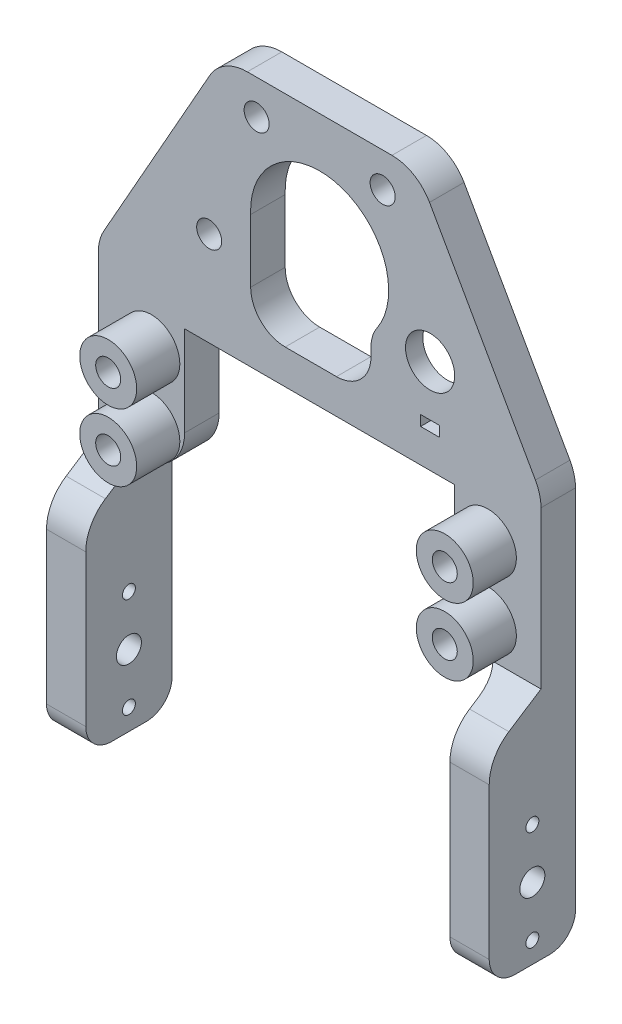
from build123d import *
from OCP.BRepFilletAPI import BRepFilletAPI_MakeChamfer

# Parameters (mm, degrees)
SKETCH1_W                = 65.151
SKETCH1_H                = 29.718
SKETCH1_R                = 1.8415
SKETCH1_W_2              = 39.751
SKETCH1_H_2              = 19.558
BOSS_EXTRUDE1_DEPTH      = 5.08
SKETCH2_R                = 4.191
SKETCH2_R_2              = 1.8415
BOSS_EXTRUDE2_DEPTH      = 6.35
SKETCH3_R                = 1.8415
SKETCH3_R_2              = 3.6195
SKETCH3_R_3              = 10.16
SKETCH3_W                = 20.32
SKETCH3_H                = 10.16
BOSS_EXTRUDE3_DEPTH      = 5.08
CUT_EXTRUDE1_DEPTH       = 2.54
CUT_EXTRUDE2_DEPTH       = 78.913404351
CUT_EXTRUDE2_DEPTH_BACK  = 78.913404351
SKETCH5_W                = 2.794
SKETCH5_H                = 1.524
FILLET1_R                = 6.35
CHAMFER1_SIZE            = 6.35
CUT_EXTRUDE3_DEPTH       = 79.243922304
CUT_EXTRUDE3_DEPTH_BACK  = 79.243922304
SKETCH7_W                = 5.7785
SKETCH7_H                = 38.1
BOSS_EXTRUDE4_DEPTH      = 12.7
CUT_EXTRUDE4_DEPTH       = 84.227055894
CUT_EXTRUDE4_DEPTH_BACK  = 84.227055894
SKETCH8_R                = 1.8415
SKETCH8_W                = 41.273071729
SKETCH8_H                = 30.163795182
CUT_EXTRUDE7_DEPTH       = 79.439508397
CUT_EXTRUDE7_DEPTH_BACK  = 79.439508397
SKETCH13_W               = 7.413158878
SKETCH13_H               = 5.0165
SKETCH13_W_2             = 10.14650482
CHAMFER2_SIZE            = 4.94848586
CHAMFER2_SIZE_2          = 7.62
FILLET4_R                = 3.81
CUT_EXTRUDE9_DEPTH       = 88.443135108
CUT_EXTRUDE9_DEPTH_BACK  = 88.443135108
SKETCH16_R               = 0.9525
FILLET5_R                = 6.35
FILLET6_R                = 2.54
FILLET7_START            = -14
FILLET7_DEPTH            = 67
CUT_EXTRUDE10_DEPTH      = 78.778730238
CUT_EXTRUDE10_DEPTH_BACK = 78.778730238
FILLET8_R                = 5.08


with BuildPart() as part:
    # Sketch1 → Boss-Extrude1 (new body)
    with BuildSketch(Plane.XY):
        with Locations((19.8755, 9.779)):
            Rectangle(SKETCH1_W, SKETCH1_H)
        with Locations((-4.8895, 14.732)):
            Circle(SKETCH1_R, mode=Mode.SUBTRACT)
        with Locations((-4.8895, 4.826)):
            Circle(SKETCH1_R, mode=Mode.SUBTRACT)
        with Locations((44.6405, 14.732)):
            Circle(SKETCH1_R, mode=Mode.SUBTRACT)
        with Locations((44.6405, 4.826)):
            Circle(SKETCH1_R, mode=Mode.SUBTRACT)
        with Locations((19.8755, 9.779)):
            Rectangle(SKETCH1_W_2, SKETCH1_H_2, mode=Mode.SUBTRACT)
    extrude(amount=BOSS_EXTRUDE1_DEPTH)

    # Sketch2 → Boss-Extrude2 (add)
    # profile 1 of 4: a face of its own
    with BuildSketch(Plane.XY.offset(5.08)):
        with Locations((-4.8895, 14.732)):
            Circle(SKETCH2_R)
        with Locations((-4.8895, 14.732)):
            Circle(SKETCH2_R_2, mode=Mode.SUBTRACT)
    # profile 2 of 4: a face of its own
    with BuildSketch(Plane.XY.offset(5.08)):
        with Locations((-4.8895, 4.826)):
            Circle(SKETCH2_R)
        with Locations((-4.8895, 4.826)):
            Circle(SKETCH2_R_2, mode=Mode.SUBTRACT)
    # profile 3 of 4: a face of its own
    with BuildSketch(Plane.XY.offset(5.08)):
        with Locations((44.6405, 14.732)):
            Circle(SKETCH2_R)
        with Locations((44.6405, 14.732)):
            Circle(SKETCH2_R_2, mode=Mode.SUBTRACT)
    # profile 4 of 4: a face of its own
    with BuildSketch(Plane.XY.offset(5.08)):
        with Locations((44.6405, 4.826)):
            Circle(SKETCH2_R)
        with Locations((44.6405, 4.826)):
            Circle(SKETCH2_R_2, mode=Mode.SUBTRACT)
    extrude(amount=BOSS_EXTRUDE2_DEPTH)

    # Sketch3 → Boss-Extrude3 (add)
    # profile 1 of 2: a face of its own
    with BuildSketch(Plane.XY.offset(5.08)):
        Polygon((34.7345, 25.999651961), (37.5285, 25.999651961), (37.5285, 24.638), (52.451, 24.638), (34.2265, 56.924151961), (5.5245, 56.924151961), (-12.7, 24.638), (34.7345, 24.638), align=None)
        with Locations((3.6195, 33.429151961)):
            Circle(SKETCH3_R, mode=Mode.SUBTRACT)
        with Locations((10.6045, 51.844151961)):
            Circle(SKETCH3_R, mode=Mode.SUBTRACT)
        with Locations((36.1315, 33.429151961)):
            Circle(SKETCH3_R_2, mode=Mode.SUBTRACT)
        with Locations((19.8755, 39.461651961)):
            Circle(SKETCH3_R_3, mode=Mode.SUBTRACT)
        with Locations((29.1465, 51.844151961)):
            Circle(SKETCH3_R, mode=Mode.SUBTRACT)
    # profile 2 of 2: a face of its own
    with BuildSketch(Plane.XY.offset(5.08)):
        with Locations((19.8755, -10.16)):
            Rectangle(SKETCH3_W, SKETCH3_H)
        with Locations((14.7955, -10.16)):
            Circle(SKETCH3_R, mode=Mode.SUBTRACT)
        with Locations((24.9555, -10.16)):
            Circle(SKETCH3_R, mode=Mode.SUBTRACT)
    extrude(amount=-BOSS_EXTRUDE3_DEPTH)

    # Sketch4 → Cut-Extrude1 (cut)
    with BuildSketch(Plane(origin=(0, 0, 0), x_dir=(-1, 0, 0), z_dir=(0, 0, -1))):
        with BuildLine():
            Line((-34.657278026, 40.905184972), (-19.8755, 39.461651961))
            Line((-19.8755, 39.461651961), (-30.610615013, 28.177082944))
            ThreePointArc((-30.610615013, 28.177082944), (-43.393319721, 31.120391613), (-34.657278026, 40.905184972))
        make_face()
    extrude(amount=-CUT_EXTRUDE1_DEPTH, mode=Mode.SUBTRACT)

    # Sketch5 → Cut-Extrude2 (cut, two sides: drawn at the far end of the back side and taken through both)
    with BuildSketch(Plane(origin=(0, 0, 2.54), x_dir=(-1, 0, 0), z_dir=(0, 0, -1)).offset(-CUT_EXTRUDE2_DEPTH_BACK)):
        with Locations((-36.1315, 25.237651961)):
            Rectangle(SKETCH5_W, SKETCH5_H)
    extrude(amount=CUT_EXTRUDE2_DEPTH + CUT_EXTRUDE2_DEPTH_BACK, mode=Mode.SUBTRACT)

    # Fillet1
    fillet1_edges = [part.edges().sort_by_distance(p)[0] for p in [
        (5.5245, 56.924151961, 2.54),
        (34.2265, 56.924151961, 2.54),
        (-12.7, 24.638, 2.54),
        (52.451, 24.638, 2.54),
    ]]
    fillet(fillet1_edges, radius=FILLET1_R)

    # Chamfer1
    chamfer1_edges = [part.edges().sort_by_distance(p)[0] for p in [
        (9.7155, -5.08, 2.54),
        (30.0355, -5.08, 2.54),
    ]]
    chamfer(chamfer1_edges, length=CHAMFER1_SIZE)

    # Sketch6 → Cut-Extrude3 (cut, two sides: drawn at the far end of the back side and taken through both)
    with BuildSketch(Plane(origin=(0, 0, 0), x_dir=(-1, 0, 0), z_dir=(0, 0, -1)).offset(-CUT_EXTRUDE3_DEPTH_BACK)):
        Polygon((-52.451, -5.08), (-39.751, -5.08), (-39.751, 0), (0, 0), (0, -5.08), (12.7, -5.08), (12.7, -17.29518095), (-52.451, -17.29518095), align=None)
    extrude(amount=CUT_EXTRUDE3_DEPTH + CUT_EXTRUDE3_DEPTH_BACK, mode=Mode.SUBTRACT)

    # Sketch7 → Boss-Extrude4 (add)
    with BuildSketch(Plane(origin=(0, 0, 0), x_dir=(-1, 0, 0), z_dir=(0, 0, -1))):
        with Locations((-49.56175, -24.13)):
            Rectangle(SKETCH7_W, SKETCH7_H)
        with Locations((9.81075, -24.13)):
            Rectangle(SKETCH7_W, SKETCH7_H)
    extrude(amount=-BOSS_EXTRUDE4_DEPTH)

    # Sketch8 → Cut-Extrude4 (cut, two sides: drawn at the far end of the back side and taken through both)
    with BuildSketch(Plane(origin=(-6.9215, 0, 0), x_dir=(0, 0, -1), z_dir=(1, 0, 0)).offset(-CUT_EXTRUDE4_DEPTH_BACK)):
        with Locations(Location((-6.35, -24.13, 0), (0, 0, 90))):
            Circle(SKETCH8_R)
        with Locations((-3.400089219, -49.689397591)):
            Rectangle(SKETCH8_W, SKETCH8_H)
    extrude(amount=CUT_EXTRUDE4_DEPTH + CUT_EXTRUDE4_DEPTH_BACK, mode=Mode.SUBTRACT)

    # Sketch13 → Cut-Extrude7 (cut, two sides: drawn at the far end of the back side and taken through both)
    with BuildSketch(Plane(origin=(0, 0, 0), x_dir=(-1, 0, 0), z_dir=(0, 0, -1)).offset(-CUT_EXTRUDE7_DEPTH_BACK)):
        with Locations((-42.965920561, -2.57175)):
            Rectangle(SKETCH13_W, SKETCH13_H)
        with Locations((1.84824759, -2.57175)):
            Rectangle(SKETCH13_W_2, SKETCH13_H)
    extrude(amount=CUT_EXTRUDE7_DEPTH + CUT_EXTRUDE7_DEPTH_BACK, mode=Mode.SUBTRACT)

    # Chamfer2
    chamfer2_edges_1 = [part.edges().sort_by_distance(p)[0] for p in [
        (-9.81075, -5.08, 5.08),
    ]]
    chamfer2_side_1 = [part.faces().sort_by_distance(p)[0] for p in [
        (-9.81075, -4.981030283, 5.08),
    ]]
    chamfer2_edges_2 = [part.edges().sort_by_distance(p)[0] for p in [
        (49.56175, -5.08, 5.08),
    ]]
    chamfer2_side_2 = [part.faces().sort_by_distance(p)[0] for p in [
        (49.56175, -4.981030283, 5.08),
    ]]
    chamfer2 = BRepFilletAPI_MakeChamfer(part.part.solid().wrapped)
    for e in chamfer2_edges_1:
        chamfer2.Add(CHAMFER2_SIZE - 0.0001, CHAMFER2_SIZE_2 - 0.0001, e.wrapped, chamfer2_side_1[0].wrapped)
    for e in chamfer2_edges_2:
        chamfer2.Add(CHAMFER2_SIZE - 0.0001, CHAMFER2_SIZE_2 - 0.0001, e.wrapped, chamfer2_side_2[0].wrapped)
    add(Compound.cast(chamfer2.Shape()), mode=Mode.REPLACE)  # a hair under: the kernel refuses the full size

    # Fillet4
    fillet4_edges = [part.edges().sort_by_distance(p)[0] for p in [
        (-9.81075, -34.6075, 12.7),
        (49.56175, -34.6075, 0),
        (49.56175, -34.6075, 12.7),
        (-9.81075, -34.6075, 0),
    ]]
    fillet(fillet4_edges, radius=FILLET4_R)

    # Sketch16 → Cut-Extrude9 (cut, two sides: drawn at the far end of the back side and taken through both)
    with BuildSketch(Plane(origin=(52.451, 0, 0), x_dir=(0, 0, -1), z_dir=(1, 0, 0)).offset(-CUT_EXTRUDE9_DEPTH_BACK)):
        with Locations(Location((-6.35, -16.764, 0), (0, 0, 90))):
            Circle(SKETCH16_R)
        with Locations(Location((-6.35, -31.496, 0), (0, 0, 90))):
            Circle(SKETCH16_R)
    extrude(amount=CUT_EXTRUDE9_DEPTH + CUT_EXTRUDE9_DEPTH_BACK, mode=Mode.SUBTRACT)

    # Fillet5
    fillet5_edges = [part.edges().sort_by_distance(p)[0] for p in [
        (39.751, -0.0635, 2.54),
        (0, -0.0635, 2.54),
    ]]
    fillet(fillet5_edges, radius=FILLET5_R)

    # Fillet6
    # the kernel refuses this fillet: 2.54 mm, written as the material it adds along each edge
    with BuildSketch(Plane(origin=(-6.9215, -0.0635, 10.878299782), x_dir=(0.9968383598531511, 0.07945617864760274, 0), z_dir=(0, 0, -1))) as fillet6_piece_1_section:
        with BuildLine():
            CenterArc((2.347685137, 2.513805752), FILLET6_R, 184.557307561, 77.207046273)
            Line((-0.184284297, 2.311987058), (-0.437481241, 2.291805188))
            Line((-0.437481241, 2.291805188), (-0.253196943, -0.020181869))
            Line((-0.253196943, -0.020181869), (0.020181869, -0.253196943))
            ThreePointArc((0.020181869, -0.253196943), (0.589874992, -0.207787737), (1.947459477, -0.251380575))
            Line((1.947459477, -0.251380575), (1.983843628, 0))
        make_face()
    fillet6_piece_1 = extrude(amount=10.878299782, mode=Mode.PRIVATE)
    fillet6_piece_1 = split(fillet6_piece_1, bisect_by=Plane(origin=(-6.9215, -0.0635, 5.08), z_dir=(0, 0, 1)), keep=Keep.TOP, mode=Mode.PRIVATE)
    fillet6_piece_1 = split(fillet6_piece_1, bisect_by=Plane(origin=(-6.9215, -2.759907111, 9.127244936), z_dir=(0, -0.8386723305166582, -0.5446363208837226)), keep=Keep.TOP, mode=Mode.PRIVATE)
    add(fillet6_piece_1)
    with BuildSketch(Plane(origin=(-6.9215, -0.0635, 5.08), x_dir=(0.9968383598531511, 0.07945617864760274, 0), z_dir=(0, 0, -1))) as fillet6_piece_2_section:
        with BuildLine():
            CenterArc((2.347685137, 2.513805752), FILLET6_R, 184.557307561, 77.207046273)
            Line((-0.184284297, 2.311987058), (-0.437481241, 2.291805188))
            Line((-0.437481241, 2.291805188), (-0.253196943, -0.020181869))
            Line((-0.253196943, -0.020181869), (0.020181869, -0.253196943))
            ThreePointArc((0.020181869, -0.253196943), (0.589874992, -0.207787737), (1.947459477, -0.251380575))
            Line((1.947459477, -0.251380575), (1.983843628, 0))
        make_face()
    fillet6_piece_2 = extrude(amount=5.08, mode=Mode.PRIVATE)
    fillet6_piece_2 = split(fillet6_piece_2, bisect_by=Plane(origin=(-6.9215, -0.11140953, 5.048887408), z_dir=(0, 0.8386723305166582, 0.5446363208837226)), keep=Keep.TOP, mode=Mode.PRIVATE)
    add(fillet6_piece_2)
    with BuildSketch(Plane(origin=(-6.9215, -0.0635, 5.08), x_dir=(0.9968383598531511, 0.07945617864760274, 0), z_dir=(0, 0, -1))) as fillet6_piece_3_section:
        with BuildLine():
            CenterArc((2.347685137, 2.513805752), FILLET6_R, 184.557307561, 77.207046273)
            Line((-0.184284297, 2.311987058), (-0.437481241, 2.291805188))
            Line((-0.437481241, 2.291805188), (-0.253196943, -0.020181869))
            Line((-0.253196943, -0.020181869), (0.020181869, -0.253196943))
            ThreePointArc((0.020181869, -0.253196943), (0.589874992, -0.207787737), (1.947459477, -0.251380575))
            Line((1.947459477, -0.251380575), (1.983843628, 0))
        make_face()
    fillet6_piece_3 = extrude(amount=5.08, mode=Mode.PRIVATE)
    fillet6_piece_3 = split(fillet6_piece_3, bisect_by=Plane(origin=(-6.9215, -0.11140953, 5.048887408), z_dir=(0, -0.8386723305166582, -0.5446363208837226)), keep=Keep.TOP, mode=Mode.PRIVATE)
    add(fillet6_piece_3)
    with BuildSketch(Plane(origin=(46.6725, -0.0635, 0), x_dir=(-0.996838359853151, 0.07945617864760328, 0), z_dir=(0, 0, 1))) as fillet6_piece_4_section:
        with BuildLine():
            CenterArc((2.347685137, 2.513805752), FILLET6_R, 184.557307561, 77.207046273)
            Line((-0.184284297, 2.311987058), (-0.437481241, 2.291805188))
            Line((-0.437481241, 2.291805188), (-0.253196943, -0.020181869))
            Line((-0.253196943, -0.020181869), (0.020181869, -0.253196943))
            ThreePointArc((0.020181869, -0.253196943), (0.589874992, -0.207787737), (1.947459477, -0.251380575))
            Line((1.947459477, -0.251380575), (1.983843628, 0))
        make_face()
    fillet6_piece_4 = extrude(amount=5.08, mode=Mode.PRIVATE)
    fillet6_piece_4 = split(fillet6_piece_4, bisect_by=Plane(origin=(46.6725, 2.208989246, 1.475761316), z_dir=(0, -0.8386723305166582, -0.5446363208837226)), keep=Keep.TOP, mode=Mode.PRIVATE)
    add(fillet6_piece_4)
    with BuildSketch(Plane(origin=(46.6725, -0.0635, 0), x_dir=(-0.996838359853151, 0.07945617864760328, 0), z_dir=(0, 0, 1))) as fillet6_piece_5_section:
        with BuildLine():
            CenterArc((2.347685137, 2.513805752), FILLET6_R, 184.557307561, 77.207046273)
            Line((-0.184284297, 2.311987058), (-0.437481241, 2.291805188))
            Line((-0.437481241, 2.291805188), (-0.253196943, -0.020181869))
            Line((-0.253196943, -0.020181869), (0.020181869, -0.253196943))
            ThreePointArc((0.020181869, -0.253196943), (0.589874992, -0.207787737), (1.947459477, -0.251380575))
            Line((1.947459477, -0.251380575), (1.983843628, 0))
        make_face()
    fillet6_piece_5 = extrude(amount=10.878299782, mode=Mode.PRIVATE)
    fillet6_piece_5 = split(fillet6_piece_5, bisect_by=Plane(origin=(46.6725, -0.0635, 5.08), z_dir=(0, 0, 1)), keep=Keep.TOP, mode=Mode.PRIVATE)
    fillet6_piece_5 = split(fillet6_piece_5, bisect_by=Plane(origin=(46.6725, 2.208989246, 1.475761316), z_dir=(0, -0.8386723305166582, -0.5446363208837226)), keep=Keep.TOP, mode=Mode.PRIVATE)
    add(fillet6_piece_5)
    with BuildSketch(Plane(origin=(46.6725, -0.0635, 0), x_dir=(-0.996838359853151, 0.07945617864760328, 0), z_dir=(0, 0, 1))) as fillet6_piece_6_section:
        with BuildLine():
            CenterArc((2.347685137, 2.513805752), FILLET6_R, 184.557307561, 77.207046273)
            Line((-0.184284297, 2.311987058), (-0.437481241, 2.291805188))
            Line((-0.437481241, 2.291805188), (-0.253196943, -0.020181869))
            Line((-0.253196943, -0.020181869), (0.020181869, -0.253196943))
            ThreePointArc((0.020181869, -0.253196943), (0.589874992, -0.207787737), (1.947459477, -0.251380575))
            Line((1.947459477, -0.251380575), (1.983843628, 0))
        make_face()
    fillet6_piece_6 = extrude(amount=5.08, mode=Mode.PRIVATE)
    fillet6_piece_6 = split(fillet6_piece_6, bisect_by=Plane(origin=(46.6725, 2.208989246, 1.475761316), z_dir=(0, 0.8386723305166582, 0.5446363208837226)), keep=Keep.TOP, mode=Mode.PRIVATE)
    add(fillet6_piece_6)

    # Fillet7: read off the stored shape, not the designer's step
    # Fillet7 outline → Fillet7 (cut)
    with BuildSketch(Plane.YZ.offset(FILLET7_START)):
        with BuildLine():
            Line((-5.08, 12.7), (-8.527768693, 12.7))
            ThreePointArc((-8.527768693, 12.7), (-5.497810565, 11.930488665), (-3.202210586, 9.808457872))
            Line((-3.202210586, 9.808457872), (-5.08, 12.7))
        make_face()
    extrude(amount=FILLET7_DEPTH, mode=Mode.SUBTRACT)

    # Sketch17 → Cut-Extrude10 (cut, two sides: drawn at the far end of the back side and taken through both)
    with BuildSketch(Plane.XY.offset(5.08).offset(-CUT_EXTRUDE10_DEPTH_BACK)):
        with BuildLine():
            Line((9.726528391, 24.638), (27.432, 24.638))
            Line((27.432, 24.638), (27.432, 32.670119899))
            ThreePointArc((27.432, 32.670119899), (16.460772064, 29.892679544), (9.726528391, 38.988391693))
            Line((9.726528391, 38.988391693), (9.726528391, 24.638))
        make_face()
    extrude(amount=CUT_EXTRUDE10_DEPTH + CUT_EXTRUDE10_DEPTH_BACK, mode=Mode.SUBTRACT)

    # Fillet8
    fillet8_edges = [part.edges().sort_by_distance(p)[0] for p in [
        (9.726528391, 24.638, 2.54),
        (27.432, 24.638, 2.54),
        (27.432, 32.670119899, 3.81),
    ]]
    fillet(fillet8_edges, radius=FILLET8_R)


solid = part.part
